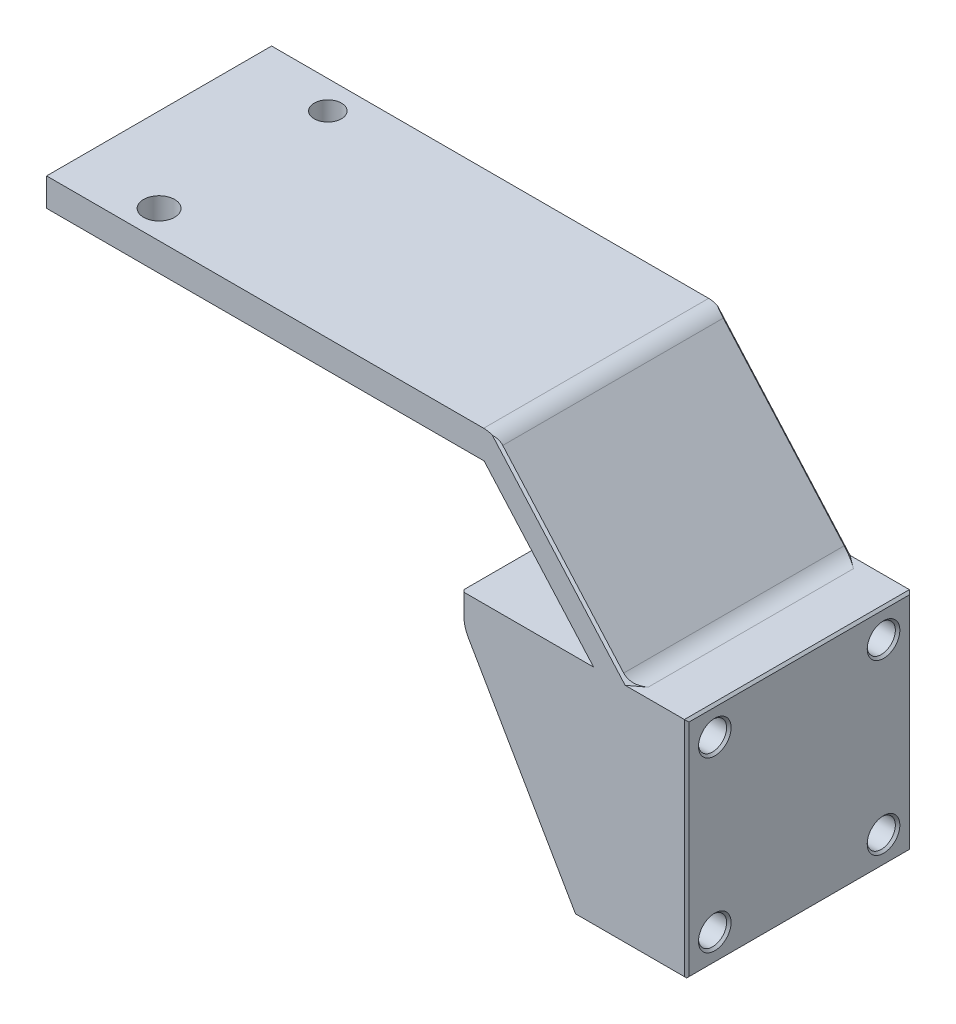
from build123d import *
from OCP.BRepFilletAPI import BRepFilletAPI_MakeChamfer

# Parameters (mm, degrees)
SKETCH1_W           = 50.8
SKETCH1_H           = 50.8
BOSS_EXTRUDE1_DEPTH = 50.8
CUT_EXTRUDE1_DEPTH  = 50.8
SKETCH4_R           = 3.175
CUT_EXTRUDE2_DEPTH  = 12.7
SKETCH5_R           = 3.175
CUT_EXTRUDE3_DEPTH  = 12.7
CHAMFER1_SIZE       = 0.508
CHAMFER3_SIZE       = 0.508
CHAMFER3_SIZE2      = 1.38788181
FILLET3_R           = 7.62
BOSS_EXTRUDE2_DEPTH = 50.8
CHAMFER4_SIZE       = 0.508
CHAMFER5_SIZE       = 0.508
SKETCH7_R           = 3.079866406
SKETCH7_R_2         = 3.504854353
CUT_EXTRUDE4_DEPTH  = 19.05
SKETCH9_W           = 60.012063762
SKETCH9_H           = 6.35
BOSS_EXTRUDE4_DEPTH = 12.7
SKETCH10_W          = 6.35
SKETCH10_H          = 37.305371191
BOSS_EXTRUDE5_DEPTH = 12.7
FILLET6_R           = 5.08


with BuildPart() as part:
    # Sketch1 → Boss-Extrude1 (new body)
    with BuildSketch(Plane.XY):
        Rectangle(SKETCH1_W, SKETCH1_H)
    extrude(amount=BOSS_EXTRUDE1_DEPTH)

    # Sketch2 → Cut-Extrude1 (cut)
    with BuildSketch(Plane.XY.offset(50.8)):
        Polygon((-25.4, 18.594090512), (0, -25.4), (-25.4, -25.4), align=None)
    extrude(amount=-CUT_EXTRUDE1_DEPTH, mode=Mode.SUBTRACT)

    # Sketch4 → Cut-Extrude2 (cut)
    with BuildSketch(Plane(origin=(25.4, 0, 0), x_dir=(0, 0, -1), z_dir=(1, 0, 0))):
        with Locations((-44.45, 19.05)):
            Circle(SKETCH4_R)
        with Locations((-6.35, 19.05)):
            Circle(SKETCH4_R)
        with Locations((-6.35, -19.05)):
            Circle(SKETCH4_R)
        with Locations((-44.45, -19.05)):
            Circle(SKETCH4_R)
    extrude(amount=-CUT_EXTRUDE2_DEPTH, mode=Mode.SUBTRACT)

    # Sketch5 → Cut-Extrude3 (cut)
    with BuildSketch(Plane(origin=(-10.998522628, -6.35, 0), x_dir=(0, 0, 1), z_dir=(-0.8660254037844364, -0.5000000000000041, 0))):
        with Locations(Location((6.35, 22.452954744, 0), (0, 0, 270))):
            Circle(SKETCH5_R)
        with Locations(Location((44.45, 22.452954744, 0), (0, 0, 270))):
            Circle(SKETCH5_R)
        with Locations(Location((44.45, -15.647045256, 0), (0, 0, 270))):
            Circle(SKETCH5_R)
        with Locations(Location((6.35, -15.647045256, 0), (0, 0, 270))):
            Circle(SKETCH5_R)
    extrude(amount=-CUT_EXTRUDE3_DEPTH, mode=Mode.SUBTRACT)

    # Chamfer1
    chamfer1_edges = [part.edges().sort_by_distance(p)[0] for p in [
        (25.4, -19.05, 47.625),
        (25.4, -19.05, 9.525),
        (25.4, 19.05, 9.525),
        (25.4, 19.05, 47.625),
        (25.4, 0, 50.8),
        (25.4, 0, 0),
        (25.4, -25.4, 25.4),
        (25.4, 25.4, 25.4),
    ]]
    chamfer(chamfer1_edges, length=CHAMFER1_SIZE)

    # Chamfer3: one chamfer whose edges measure the first distance from different faces: ONE call of the kernel's chamfer builder (chamfer() names one face for all edges)
    chamfer3_edges_1 = [part.edges().sort_by_distance(p)[0] for p in [
        (0, -25.4, 25.4),
    ]]
    chamfer3_side_1 = [part.faces().sort_by_distance(p)[0] for p in [
        (12.446, -25.4, 25.4),
    ]]
    chamfer3_edges_2 = [part.edges().sort_by_distance(p)[0] for p in [
        (-4.7625, -17.151108029, 6.35),
        (-4.7625, -17.151108029, 44.45),
        (-23.8125, 15.844459855, 44.45),
        (-23.8125, 15.844459855, 6.35),
    ]]
    chamfer3 = BRepFilletAPI_MakeChamfer(part.part.solid().wrapped)
    for e in chamfer3_edges_1:
        chamfer3.Add(CHAMFER3_SIZE, CHAMFER3_SIZE2, e.wrapped, chamfer3_side_1[0].wrapped)  # the first distance lies on this face
    for e in chamfer3_edges_2:
        chamfer3.Add(CHAMFER3_SIZE, e.wrapped)
    add(Compound.cast(chamfer3.Shape()), mode=Mode.REPLACE)

    # Fillet3
    fillet3_edges = [part.edges().sort_by_distance(p)[0] for p in [
        (-25.4, 18.594090512, 25.4),
    ]]
    fillet(fillet3_edges, radius=FILLET3_R)

    # Sketch6 → Boss-Extrude2 (add, through all)
    with BuildSketch(Plane(origin=(0, 0, 0), x_dir=(-1, 0, 0), z_dir=(0, 0, -1))):
        Polygon((18.145405324, 59.69), (-12.192, 25.4), (-3.713506547, 25.4), (21.005860753, 53.34), (119.117924515, 53.34), (119.117924515, 59.69), align=None)
    extrude(amount=-BOSS_EXTRUDE2_DEPTH)

    # Chamfer4
    # the kernel refuses this chamfer: 0.508 mm, written as the material it takes off along each edge
    with BuildSketch(Plane(origin=(-0.798414958, -25.4, 0), x_dir=(0, 0.9996219169112968, -0.027495876610586417), z_dir=(1, 0, 0)), Plane(origin=(-0.798414958, -25.4, 50.8), x_dir=(0, -0.027495876610587118, -0.9996219169112968), z_dir=(1, 0, 0))) as chamfer4_piece_1:
        Polygon((CHAMFER4_SIZE * 0.999621916911, CHAMFER4_SIZE * 0.0274958766106), (-CHAMFER4_SIZE * 0.0274958766106, CHAMFER4_SIZE * 0.999621916911), (0, 0), align=None)
    extrude(amount=26.996829916, mode=Mode.SUBTRACT)
    with BuildSketch(Plane(origin=(-25.4, 26.706414958, 50.8), x_dir=(-0.027495876610587118, 0, -0.9996219169112968), z_dir=(0, -1, 0)), Plane(origin=(-25.4, 26.706414958, 0), x_dir=(0.9996219169112968, 0, -0.027495876610586417), z_dir=(0, -1, 0))) as chamfer4_piece_2:
        Polygon((CHAMFER4_SIZE * 0.999621916911, CHAMFER4_SIZE * 0.0274958766106), (-CHAMFER4_SIZE * 0.0274958766106, CHAMFER4_SIZE * 0.999621916911), (0, 0), align=None)
    extrude(amount=6.070551599, mode=Mode.SUBTRACT)
    with BuildSketch(Plane(origin=(-17.78, 20.635863359, 50.8), x_dir=(-0.8660254037844363, -0.5000000000000041, 0), z_dir=(0.5000000000000041, -0.8660254037844363, 0))) as chamfer4_piece_3:
        Polygon((7.62, CHAMFER4_SIZE), (7.62 - CHAMFER4_SIZE, 0), (7.62, 0), align=None)
    revolve(axis=Axis((-17.78, 20.635863359, 50.8), (0, 0, -1)), revolution_arc=30, mode=Mode.SUBTRACT)
    with BuildSketch(Plane(origin=(-24.379113577, 16.825863359, 50.8), x_dir=(-0.023812127644096983, -0.013747938305297273, -0.9996219169112965), z_dir=(0.5000000000000041, -0.8660254037844363, 0)), Plane(origin=(-24.379113577, 16.825863359, 0), x_dir=(0.8656979742248779, 0.4998109584556525, -0.027495876610586285), z_dir=(0.5000000000000041, -0.8660254037844363, 0))) as chamfer4_piece_4:
        Polygon((CHAMFER4_SIZE * 0.999621916911, CHAMFER4_SIZE * 0.0274958766106), (-CHAMFER4_SIZE * 0.0274958766106, CHAMFER4_SIZE * 0.999621916911), (0, 0), align=None)
    extrude(amount=48.676760301, mode=Mode.SUBTRACT)
    with BuildSketch(Plane(origin=(-17.78, 20.635863359, 0), x_dir=(-0.8660254037844363, -0.5000000000000041, 0), z_dir=(0.5000000000000041, -0.8660254037844363, 0))) as chamfer4_piece_5:
        Polygon((7.62 - CHAMFER4_SIZE, 0), (7.62, -CHAMFER4_SIZE), (7.62, 0), align=None)
    revolve(axis=Axis((-17.78, 20.635863359, 0), (0, 0, -1)), revolution_arc=30, mode=Mode.SUBTRACT)

    # Chamfer5
    chamfer5_edges = [part.edges().sort_by_distance(p)[0] for p in [
        (-8.646177103, 39.37, 0),
        (-2.976702662, 42.545, 0),
        (-8.646177103, 39.37, 50.8),
        (-2.976702662, 42.545, 50.8),
    ]]
    chamfer(chamfer5_edges, length=CHAMFER5_SIZE)

    # Sketch7 → Cut-Extrude4 (cut)
    with BuildSketch(Plane(origin=(0, 59.69, 0), x_dir=(1, 0, 0), z_dir=(0, 1, 0))):
        with Locations(Location((-100.067924515, -6.35, 0), (0, 0, 270))):
            Circle(SKETCH7_R)
        with Locations(Location((-100.067924515, -44.45, 0), (0, 0, 270))):
            Circle(SKETCH7_R_2)
    extrude(amount=-CUT_EXTRUDE4_DEPTH, mode=Mode.SUBTRACT)

    # Sketch9 → Boss-Extrude4 (add)
    with BuildSketch(Plane(origin=(0, 53.34, 0), x_dir=(-1, 0, 0), z_dir=(0, -1, 0))):
        with Locations((51.011892634, -25.4)):
            Rectangle(SKETCH9_W, SKETCH9_H)
    extrude(amount=BOSS_EXTRUDE4_DEPTH)

    # Sketch10 → Boss-Extrude5 (add)
    with BuildSketch(Plane(origin=(14.688369002, 12.995246543, 0), x_dir=(0, 0, 1), z_dir=(-0.7489538130165907, -0.6626222045539297, 0))):
        with Locations((25.4, 35.215460552)):
            Rectangle(SKETCH10_W, SKETCH10_H)
    extrude(amount=BOSS_EXTRUDE5_DEPTH)

    # Fillet6
    fillet6_edges = [part.edges().sort_by_distance(p)[0] for p in [
        (-51.011892634, 53.34, 22.225),
        (-8.646177103, 39.37, 22.225),
        (-8.646177103, 39.37, 28.575),
        (-51.011892634, 53.34, 28.575),
        (-13.243480358, 25.4, 25.4),
        (3.713506547, 25.4, 39.4335),
        (3.713506547, 25.4, 11.3665),
        (-21.005860753, 53.34, 39.4335),
        (-21.005860753, 53.34, 11.3665),
        (-18.145405324, 59.69, 25.4),
        (12.192, 25.4, 25.4),
    ]]
    fillet(fillet6_edges, radius=FILLET6_R)


solid = part.part
